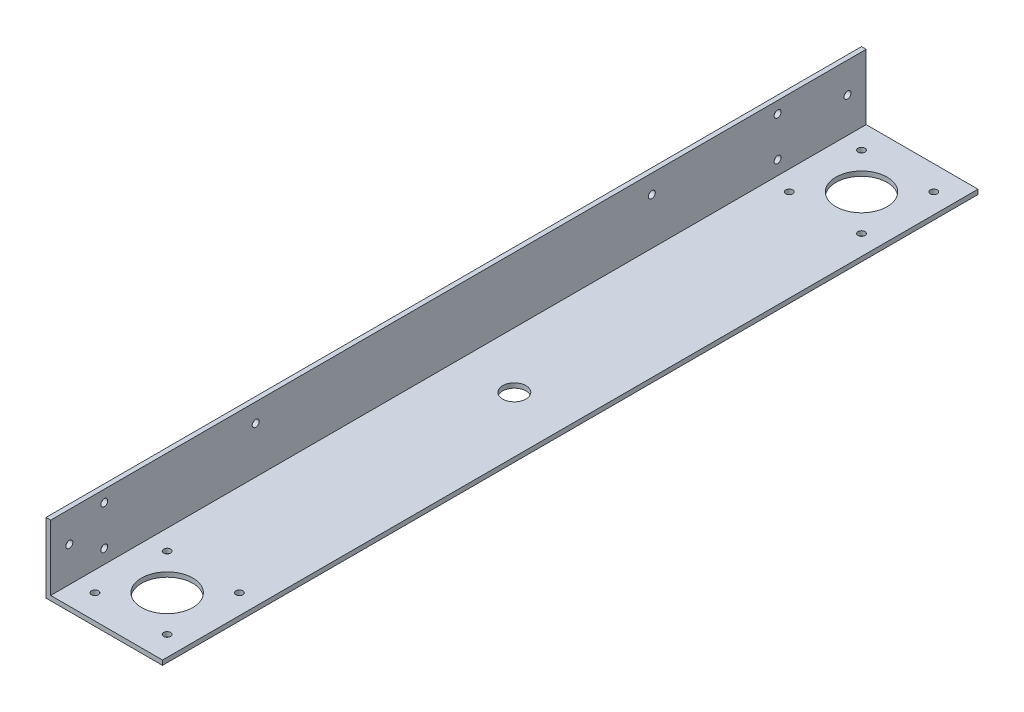
from build123d import *

# Parameters (mm, degrees)
BOSS_EXTRUDE1_DEPTH      = 350
SKETCH6_R                = 1.5
CUT_EXTRUDE3_DEPTH       = 355.660400947
SKETCH7_R                = 11
CUT_EXTRUDE4_DEPTH       = 355.660400947
SKETCH8_R                = 11
CUT_EXTRUDE5_DEPTH       = 355.823899984
SKETCH9_R                = 1.5
CUT_EXTRUDE6_DEPTH       = 355.823899984
SKETCH10_R               = 5
CUT_EXTRUDE7_DEPTH       = 355.823899984
F_3_0_3_DIAMETER_HOLE1_D = 3
F_3_0_3_DIAMETER_HOLE2_D = 3
SKETCH15_R               = 1.5
CUT_EXTRUDE8_DEPTH       = 355.823899984


with BuildPart() as part:
    # Sketch1 → Boss-Extrude1 (new body)
    with BuildSketch(Plane.XY):
        Polygon((0, 0), (0, 30), (2, 30), (2, 2), (50, 2), (50, 0), align=None)
    extrude(amount=BOSS_EXTRUDE1_DEPTH)

    # Sketch6 → Cut-Extrude3 (cut, through all)
    with BuildSketch(Plane(origin=(0, 2, 0), x_dir=(1, 0, 0), z_dir=(0, 1, 0))):
        with Locations((41.5, -339.5)):
            Circle(SKETCH6_R)
        with Locations((10.5, -308.5)):
            Circle(SKETCH6_R)
        with Locations((10.5, -339.5)):
            Circle(SKETCH6_R)
        with Locations((41.5, -308.5)):
            Circle(SKETCH6_R)
    extrude(amount=-CUT_EXTRUDE3_DEPTH, mode=Mode.SUBTRACT)

    # Sketch7 → Cut-Extrude4 (cut, through all)
    with BuildSketch(Plane(origin=(0, 2, 0), x_dir=(1, 0, 0), z_dir=(0, 1, 0))):
        with Locations((26, -324)):
            Circle(SKETCH7_R)
    extrude(amount=-CUT_EXTRUDE4_DEPTH, mode=Mode.SUBTRACT)

    # Sketch8 → Cut-Extrude5 (cut, through all)
    with BuildSketch(Plane(origin=(0, 0, 0), x_dir=(-1, 0, 0), z_dir=(0, -1, 0))):
        with Locations((-26, -26)):
            Circle(SKETCH8_R)
    extrude(amount=-CUT_EXTRUDE5_DEPTH, mode=Mode.SUBTRACT)

    # Sketch9 → Cut-Extrude6 (cut, through all)
    with BuildSketch(Plane.XZ):
        with Locations((41.5, 41.5)):
            Circle(SKETCH9_R)
        with Locations((10.5, 41.5)):
            Circle(SKETCH9_R)
        with Locations((10.5, 10.5)):
            Circle(SKETCH9_R)
        with Locations((41.5, 10.5)):
            Circle(SKETCH9_R)
    extrude(amount=-CUT_EXTRUDE6_DEPTH, mode=Mode.SUBTRACT)

    # Sketch10 → Cut-Extrude7 (cut, through all)
    with BuildSketch(Plane.XZ):
        with Locations((26.000000572, 175)):
            Circle(SKETCH10_R)
    extrude(amount=-CUT_EXTRUDE7_DEPTH, mode=Mode.SUBTRACT)

    # Ø3.0 (3) Diameter Hole1 (through all)
    with Locations(Plane(origin=(0, 141.67995168, 221.138003919), x_dir=(0, 0, 1), z_dir=(-1, 0, 0))):
        with Locations((105.861996081, -133.67995168), (120.861996081, -124.67995168), (105.861996081, -116.67995168)):
            Hole(F_3_0_3_DIAMETER_HOLE1_D / 2)

    # Ø3.0 (3) Diameter Hole2 (through all)
    with Locations(Plane(origin=(0, 141.67995168, 221.138003919), x_dir=(0, 0, 1), z_dir=(-1, 0, 0))):
        with Locations((-183.138003919, -133.67995168), (-213.138003919, -124.67995168), (-183.138003919, -116.67995168)):
            Hole(F_3_0_3_DIAMETER_HOLE2_D / 2)

    # Sketch15 → Cut-Extrude8 (cut, through all)
    with BuildSketch(Plane.ZY):
        with Locations((261.999999986, 22)):
            Circle(SKETCH15_R)
        with Locations((91.999999986, 22)):
            Circle(SKETCH15_R)
    extrude(amount=-CUT_EXTRUDE8_DEPTH, mode=Mode.SUBTRACT)


solid = part.part
